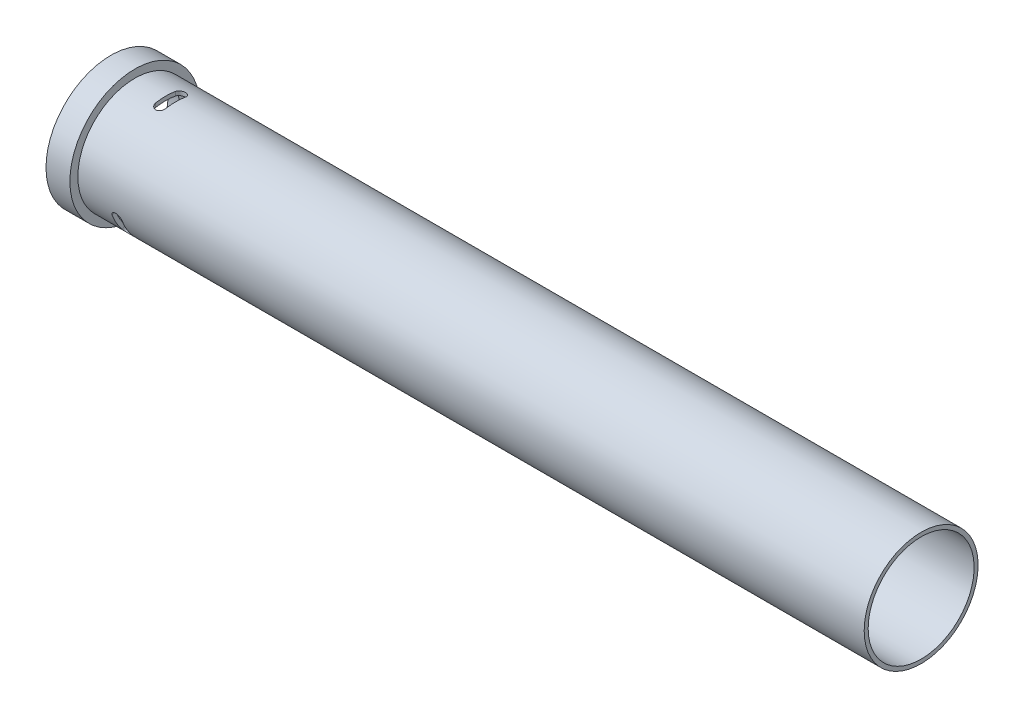
from build123d import *

# Parameters (mm, degrees)
REVOLVE1_START         = 5.08
REVOLVE1_OUTLINE_R     = 18.161
REVOLVE1_OUTLINE_R_2   = 16.891
REVOLVE1_DEPTH         = 253.238
REVOLVE1_2_OUTLINE_R   = 20.701
REVOLVE1_2_OUTLINE_R_2 = 18.161
REVOLVE1_2_DEPTH       = 7.62
CUT_EXTRUDE1_DEPTH     = 5.08
CIRPATTERN1_COUNT      = 3


# Read off the part's stored shape, not the designer's step: Revolve1
with BuildPart() as part:
    # Revolve1 outline → Revolve1 (new body)
    with BuildSketch(Plane.YZ.offset(REVOLVE1_START)):
        Circle(REVOLVE1_OUTLINE_R)
        Circle(REVOLVE1_OUTLINE_R_2, mode=Mode.SUBTRACT)
    extrude(amount=REVOLVE1_DEPTH)

    # Revolve1 2 outline → Revolve1 2 (add)
    with BuildSketch(Plane.YZ):
        Circle(REVOLVE1_2_OUTLINE_R)
        Circle(REVOLVE1_2_OUTLINE_R_2, mode=Mode.SUBTRACT)
    extrude(amount=REVOLVE1_2_DEPTH)

    # Sketch2 → Cut-Extrude1 (cut)
    with BuildSketch(Plane(origin=(0, 18.161, 0), x_dir=(1, 0, 0), z_dir=(0, 1, 0))):
        with BuildLine():
            Line((20.6375, 3.175), (20.6375, -3.175))
            ThreePointArc((20.6375, -3.175), (19.05, -4.7625), (17.4625, -3.175))
            Line((17.4625, -3.175), (17.4625, 3.175))
            ThreePointArc((17.4625, 3.175), (19.05, 4.7625), (20.6375, 3.175))
        make_face()
    cut_extrude1 = extrude(amount=-CUT_EXTRUDE1_DEPTH, mode=Mode.SUBTRACT)

    # CirPattern1: Cut-Extrude1 ×3 about axis
    cirpattern1_axis = Axis((0, 0, 0), (-1, 0, 0))
    for i in range(1, CIRPATTERN1_COUNT):
        add(cut_extrude1.rotate(cirpattern1_axis, i * 360 / CIRPATTERN1_COUNT), mode=Mode.SUBTRACT)


solid = part.part
